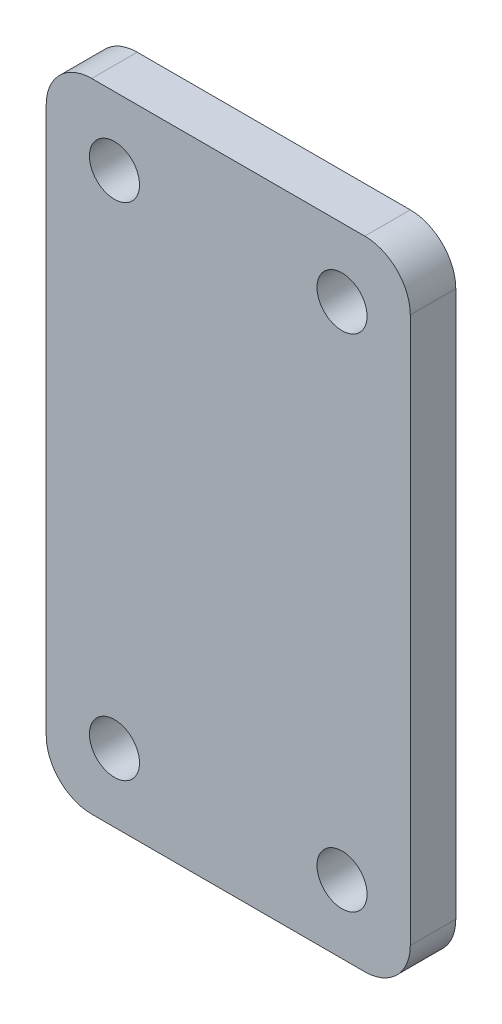
from build123d import *

# Parameters (mm, degrees)
IZIM1_W               = 80
IZIM1_H               = 140
TABAN_FLAN_1_DEPTH    = 10
RADYUS1_R             = 10
IZIM2_R               = 5.5
KES_EKSTR_ZYON1_DEPTH = 20


# Sheet-metal steps are written as plain solids
with BuildPart() as part:
    # Çizim1 → Taban-Flanş1 (new body)
    with BuildSketch(Plane.XY):
        Rectangle(IZIM1_W, IZIM1_H)
    extrude(amount=-TABAN_FLAN_1_DEPTH)

    # Radyus1
    radyus1_edges = [part.edges().sort_by_distance(p)[0] for p in [
        (40, -70, -5),
        (-40, -70, -5),
        (-40, 70, -5),
        (40, 70, -5),
    ]]
    fillet(radyus1_edges, radius=RADYUS1_R)

    # Çizim2 → Kes-Ekstrüzyon1 (cut)
    with BuildSketch(Plane.XY):
        with Locations((25, 55)):
            Circle(IZIM2_R)
        with Locations((-25, 55)):
            Circle(IZIM2_R)
        with Locations((-25, -55)):
            Circle(IZIM2_R)
        with Locations((25, -55)):
            Circle(IZIM2_R)
    extrude(amount=-KES_EKSTR_ZYON1_DEPTH, mode=Mode.SUBTRACT)


solid = part.part
